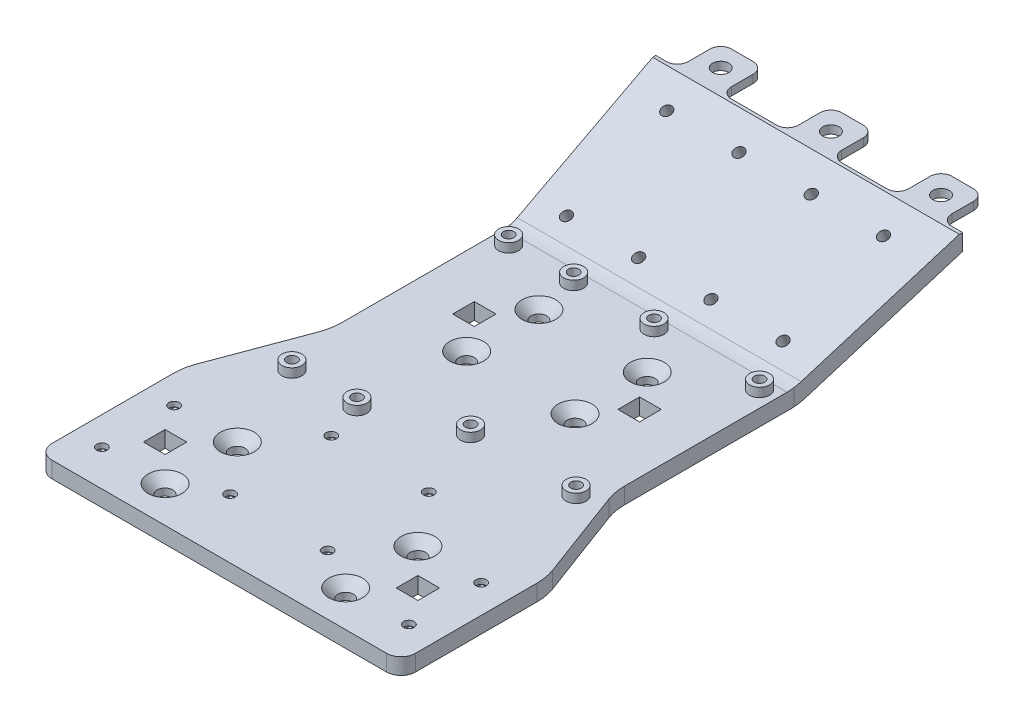
from build123d import *

# Parameters (mm, degrees)
BOSS_EXTRUDE1_DEPTH                            = 2.25
SKETCH5_W                                      = 6
SKETCH5_H                                      = 6
CUT_EXTRUDE1_DEPTH                             = 131.203132163
CSK_FOR_M4_FLAT_HEAD_MACHINE_SCREW1_AT_2_COUNT = 2
CSK_FOR_M4_FLAT_HEAD_MACHINE_SCREW1_AT_2_PITCH = 30
CSK_FOR_M4_FLAT_HEAD_MACHINE_SCREW1_AT_3_COUNT = 2
CSK_FOR_M4_FLAT_HEAD_MACHINE_SCREW1_AT_3_PITCH = 36.055512755
CSK_FOR_M4_FLAT_HEAD_MACHINE_SCREW1_AT_4_COUNT = 2
CSK_FOR_M4_FLAT_HEAD_MACHINE_SCREW1_AT_4_PITCH = 20
CSK_FOR_M4_FLAT_HEAD_MACHINE_SCREW1_AT_5_COUNT = 2
CSK_FOR_M4_FLAT_HEAD_MACHINE_SCREW1_AT_5_PITCH = 101.696853442
CSK_FOR_M4_FLAT_HEAD_MACHINE_SCREW1_AT_6_COUNT = 2
CSK_FOR_M4_FLAT_HEAD_MACHINE_SCREW1_AT_6_PITCH = 74.177152817
CSK_FOR_M4_FLAT_HEAD_MACHINE_SCREW1_AT_7_COUNT = 2
CSK_FOR_M4_FLAT_HEAD_MACHINE_SCREW1_AT_7_PITCH = 94.033238804
CSK_FOR_M4_FLAT_HEAD_MACHINE_SCREW1_AT_8_COUNT = 2
CSK_FOR_M4_FLAT_HEAD_MACHINE_SCREW1_AT_8_PITCH = 83.679447895
FILLET2_R                                      = 4
FILLET3_R                                      = 15
BOSS_EXTRUDE2_DEPTH                            = 42.5
CUT_EXTRUDE5_DEPTH                             = 132.938794996
FILLET5_R                                      = 10
SKETCH22_W                                     = 12
SKETCH22_H                                     = 12
BOSS_EXTRUDE3_DEPTH                            = 2.25
FILLET6_R                                      = 3
M4_CLEARANCE_HOLE1_D                           = 4.5
M2_5_CLEARANCE_HOLE2_D                         = 2.9
SKETCH31_R                                     = 2.75
BOSS_EXTRUDE4_DEPTH                            = 2.5
M2_5_CLEARANCE_HOLE3_D                         = 2.9
SKETCH34_W                                     = 5.1548
SKETCH34_H                                     = 5.7548
CUT_EXTRUDE6_DEPTH                             = 0.85


with BuildPart() as part:
    # Sketch1 → Boss-Extrude1 (new, symmetric)
    with BuildSketch(Plane(origin=(0, 0, 0), x_dir=(1, 0, 0), z_dir=(0, 1, 0))):
        Polygon((-39.17, 0), (39.17, 0), (39.17, -49.7), (50.325, -79.6), (50.325, -120), (-50.325, -120), (-50.325, -79.6), (-39.17, -49.7), align=None)
    extrude(amount=BOSS_EXTRUDE1_DEPTH, both=True)

    # Sketch5 → Cut-Extrude1 (cut, through all)
    with BuildSketch(Plane(origin=(0, 2.25, 0), x_dir=(1, 0, 0), z_dir=(0, 1, 0))):
        with Locations((-22.875, -26.5)):
            Rectangle(SKETCH5_W, SKETCH5_H)
        with Locations((22.875, -26.5)):
            Rectangle(SKETCH5_W, SKETCH5_H)
        with Locations((-35, -100)):
            Rectangle(SKETCH5_W, SKETCH5_H)
        with Locations((35, -100)):
            Rectangle(SKETCH5_W, SKETCH5_H)
    extrude(amount=-CUT_EXTRUDE1_DEPTH, mode=Mode.SUBTRACT)

    # Sketch7 → CSK for M4 Flat Head Machine Screw1 (revolve, cut)
    with BuildSketch(Plane(origin=(15, 2.25, 16.5), x_dir=(0, 0, 1), z_dir=(1, 0, 0))):
        Polygon((0, 0), (0, 4.5), (2.15, 4.5), (2.15, 2.55), (4.7, 0), align=None)
    csk_for_m4_flat_head_machine_screw1 = revolve(axis=Axis((15, 8.6, 16.5), (0, -1, 0)), mode=Mode.SUBTRACT)

    # CSK for M4 Flat Head Machine Screw1 at 2: CSK for M4 Flat Head Machine Screw1 ×2
    with Locations(*[(-i * CSK_FOR_M4_FLAT_HEAD_MACHINE_SCREW1_AT_2_PITCH, 0, 0) for i in range(1, CSK_FOR_M4_FLAT_HEAD_MACHINE_SCREW1_AT_2_COUNT)]):
        add(csk_for_m4_flat_head_machine_screw1, mode=Mode.SUBTRACT)

    # CSK for M4 Flat Head Machine Screw1 at 3: CSK for M4 Flat Head Machine Screw1 ×2
    with Locations(*[Vector(-0.8320502943378516, 0, 0.5547001962252174) * (i * CSK_FOR_M4_FLAT_HEAD_MACHINE_SCREW1_AT_3_PITCH) for i in range(1, CSK_FOR_M4_FLAT_HEAD_MACHINE_SCREW1_AT_3_COUNT)]):
        add(csk_for_m4_flat_head_machine_screw1, mode=Mode.SUBTRACT)

    # CSK for M4 Flat Head Machine Screw1 at 4: CSK for M4 Flat Head Machine Screw1 ×2
    with Locations(*[(0, 0, i * CSK_FOR_M4_FLAT_HEAD_MACHINE_SCREW1_AT_4_PITCH) for i in range(1, CSK_FOR_M4_FLAT_HEAD_MACHINE_SCREW1_AT_4_COUNT)]):
        add(csk_for_m4_flat_head_machine_screw1, mode=Mode.SUBTRACT)

    # CSK for M4 Flat Head Machine Screw1 at 5: CSK for M4 Flat Head Machine Screw1 ×2
    with Locations(*[Vector(-0.3933258369967201, 0, 0.9193991439798221) * (i * CSK_FOR_M4_FLAT_HEAD_MACHINE_SCREW1_AT_5_PITCH) for i in range(1, CSK_FOR_M4_FLAT_HEAD_MACHINE_SCREW1_AT_5_COUNT)]):
        add(csk_for_m4_flat_head_machine_screw1, mode=Mode.SUBTRACT)

    # CSK for M4 Flat Head Machine Screw1 at 6: CSK for M4 Flat Head Machine Screw1 ×2
    with Locations(*[Vector(0.13481240004861683, 0, 0.9908711403573786) * (i * CSK_FOR_M4_FLAT_HEAD_MACHINE_SCREW1_AT_6_PITCH) for i in range(1, CSK_FOR_M4_FLAT_HEAD_MACHINE_SCREW1_AT_6_COUNT)]):
        add(csk_for_m4_flat_head_machine_screw1, mode=Mode.SUBTRACT)

    # CSK for M4 Flat Head Machine Screw1 at 7: CSK for M4 Flat Head Machine Screw1 ×2
    with Locations(*[Vector(0.10634537454172283, 0, 0.9943292519651531) * (i * CSK_FOR_M4_FLAT_HEAD_MACHINE_SCREW1_AT_7_PITCH) for i in range(1, CSK_FOR_M4_FLAT_HEAD_MACHINE_SCREW1_AT_7_COUNT)]):
        add(csk_for_m4_flat_head_machine_screw1, mode=Mode.SUBTRACT)

    # CSK for M4 Flat Head Machine Screw1 at 8: CSK for M4 Flat Head Machine Screw1 ×2
    with Locations(*[Vector(-0.4780146261269101, 0, 0.8783518755081874) * (i * CSK_FOR_M4_FLAT_HEAD_MACHINE_SCREW1_AT_8_PITCH) for i in range(1, CSK_FOR_M4_FLAT_HEAD_MACHINE_SCREW1_AT_8_COUNT)]):
        add(csk_for_m4_flat_head_machine_screw1, mode=Mode.SUBTRACT)

    # Fillet2
    fillet2_edges = [part.edges().sort_by_distance(p)[0] for p in [
        (-50.325, 0, 120),
        (50.325, 0, 120),
    ]]
    fillet(fillet2_edges, radius=FILLET2_R)

    # Fillet3
    fillet3_edges = [part.edges().sort_by_distance(p)[0] for p in [
        (50.325, 0, 79.6),
        (39.17, 0, 49.7),
        (-50.325, 0, 79.6),
        (-39.17, 0, 49.7),
    ]]
    fillet(fillet3_edges, radius=FILLET3_R)

    # Sketch18 → Boss-Extrude2 (add, symmetric)
    with BuildSketch(Plane(origin=(0, 0, 0), x_dir=(0, 0, -1), z_dir=(1, 0, 0))):
        Polygon((0, 2.25), (42.458406944, 19.55), (43.34, 19.55), (43.34, 15.05), (0.881593056, -2.25), (0, -2.25), align=None)
    extrude(amount=BOSS_EXTRUDE2_DEPTH, both=True)

    # Sketch21 → Cut-Extrude5 (cut, through all)
    with BuildSketch(Plane.XZ.offset(2.25)):
        Polygon((39.17, 0), (42.5, -43.34), (42.5, 0), align=None)
        Polygon((-42.5, 0), (-39.17, 0), (-42.5, -43.34), align=None)
    extrude(amount=-CUT_EXTRUDE5_DEPTH, mode=Mode.SUBTRACT)

    # Fillet5
    fillet5_edges = [part.edges().sort_by_distance(p)[0] for p in [
        (0, 2.25, 0),
    ]]
    fillet(fillet5_edges, radius=FILLET5_R)
    fillet5_2_edges = [part.edges().sort_by_distance(p)[0] for p in [
        (0, -2.25, -0.881593056),
    ]]
    fillet(fillet5_2_edges, radius=FILLET5_R)

    # Sketch22 → Boss-Extrude3 (add)
    with BuildSketch(Plane(origin=(0, 19.55, 0), x_dir=(1, 0, 0), z_dir=(0, 1, 0))):
        with Locations((-30.5, 49.34)):
            Rectangle(SKETCH22_W, SKETCH22_H)
        with Locations((0, 49.34)):
            Rectangle(SKETCH22_W, SKETCH22_H)
        with Locations((30.5, 49.34)):
            Rectangle(SKETCH22_W, SKETCH22_H)
    extrude(amount=-BOSS_EXTRUDE3_DEPTH)

    # Fillet6
    fillet6_edges = [part.edges().sort_by_distance(p)[0] for p in [
        (-36.5, 18.425, -55.34),
        (-36.5, 18.425, -43.34),
        (-24.5, 18.425, -55.34),
        (-24.5, 18.425, -43.34),
        (-6, 18.425, -43.34),
        (-6, 18.425, -55.34),
        (6, 18.425, -55.34),
        (6, 18.425, -43.34),
        (24.5, 18.425, -43.34),
        (36.5, 18.425, -43.34),
        (36.5, 18.425, -55.34),
        (24.5, 18.425, -55.34),
    ]]
    fillet(fillet6_edges, radius=FILLET6_R)

    # M4 Clearance Hole1 (through all)
    with Locations(Plane(origin=(0, 19.55, 0), x_dir=(1, 0, 0), z_dir=(0, 1, 0))):
        with Locations((30.5, 49.34), (0, 49.34), (-30.5, 49.34)):
            Hole(M4_CLEARANCE_HOLE1_D / 2)

    # M2.5 Clearance Hole2 (through all)
    with Locations(Plane(origin=(0, 1.929638213, 0.786245728), x_dir=(1, 0, 0), z_dir=(0, 0.9260761220178166, 0.377336741158931))):
        with Locations((29.17, 38.34832507), (9.17, 38.34832507), (-10.83, 38.34832507), (-30.83, 38.34832507), (29.17, 8.34832507), (9.17, 8.34832507), (-10.83, 8.34832507), (-30.83, 8.34832507)):
            Hole(M2_5_CLEARANCE_HOLE2_D / 2)

    # Sketch31 → Boss-Extrude4 (add)
    with BuildSketch(Plane(origin=(0, 2.25, 0), x_dir=(1, 0, 0), z_dir=(0, 1, 0))):
        with Locations((34.725, -5.134095681)):
            Circle(SKETCH31_R)
        with Locations((5.515, -5.134095681)):
            Circle(SKETCH31_R)
        with Locations((5.515, -55.934095681)):
            Circle(SKETCH31_R)
        with Locations((34.725, -55.934095681)):
            Circle(SKETCH31_R)
        with Locations((-16.67, -5.209095681)):
            Circle(SKETCH31_R)
        with Locations((-34.67, -5.209095681)):
            Circle(SKETCH31_R)
        with Locations((-34.67, -65.209095681)):
            Circle(SKETCH31_R)
        with Locations((-16.67, -65.209095681)):
            Circle(SKETCH31_R)
    extrude(amount=BOSS_EXTRUDE4_DEPTH)

    # M2.5 Clearance Hole3 (through all)
    with Locations(Plane(origin=(0, 4.75, 0), x_dir=(1, 0, 0), z_dir=(0, 1, 0))):
        with Locations((34.725, -5.134095681), (34.725, -55.934095681), (5.515, -55.934095681), (5.515, -5.134095681), (-16.67, -5.209095681), (-16.67, -65.209095681), (-34.67, -65.209095681), (-34.67, -5.209095681), (13.5, -75.5), (-13.5, -103.5), (13.5, -103.5), (-13.5, -75.5), (-42.5, -90), (-42.5, -110), (42.5, -90), (42.5, -110)):
            Hole(M2_5_CLEARANCE_HOLE3_D / 2)

    # Sketch34 → Cut-Extrude6 (cut, symmetric)
    with BuildSketch(Plane(origin=(0, 0, 0), x_dir=(1, 0, 0), z_dir=(0, 1, 0))):
        with Locations((34.725, -5.134095681)):
            Rectangle(SKETCH34_W, SKETCH34_H)
        with Locations((34.725, -55.934095681)):
            Rectangle(SKETCH34_W, SKETCH34_H)
        with Locations((5.515, -55.934095681)):
            Rectangle(SKETCH34_W, SKETCH34_H)
        with Locations((5.515, -5.134095681)):
            Rectangle(SKETCH34_W, SKETCH34_H)
        with Locations((-16.67, -5.209095681)):
            Rectangle(SKETCH34_W, SKETCH34_H)
        with Locations((-34.67, -5.209095681)):
            Rectangle(SKETCH34_W, SKETCH34_H)
        with Locations((-16.67, -65.209095681)):
            Rectangle(SKETCH34_W, SKETCH34_H)
        with Locations((-34.67, -65.209095681)):
            Rectangle(SKETCH34_W, SKETCH34_H)
        with Locations((13.5, -75.5)):
            Rectangle(SKETCH34_W, SKETCH34_H)
        with Locations((13.5, -103.5)):
            Rectangle(SKETCH34_W, SKETCH34_H)
        with Locations((-13.5, -75.5)):
            Rectangle(SKETCH34_W, SKETCH34_H)
        with Locations((-13.5, -103.5)):
            Rectangle(SKETCH34_W, SKETCH34_H)
        with Locations((42.5, -90)):
            Rectangle(SKETCH34_W, SKETCH34_H)
        with Locations((42.5, -110)):
            Rectangle(SKETCH34_W, SKETCH34_H)
        with Locations((-42.5, -90)):
            Rectangle(SKETCH34_W, SKETCH34_H)
        with Locations((-42.5, -110)):
            Rectangle(SKETCH34_W, SKETCH34_H)
    extrude(amount=CUT_EXTRUDE6_DEPTH, both=True, mode=Mode.SUBTRACT)


solid = part.part
